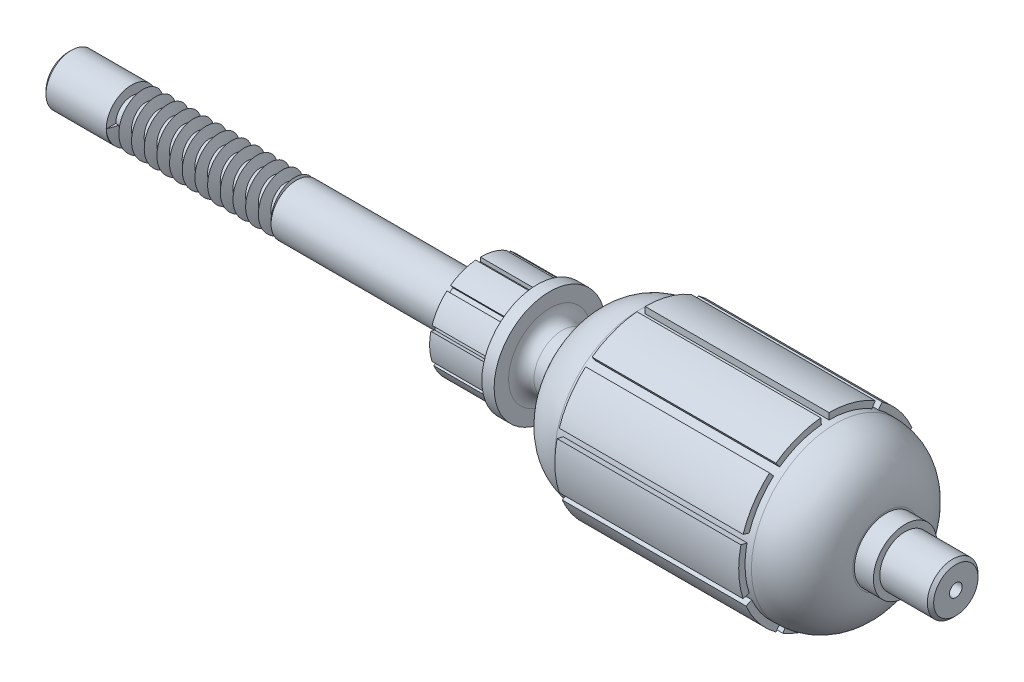
from build123d import *

# Parameters (mm, degrees)
CHANFREIN1_SIZE              = 0.5
ESQUISSE4_OUTSIDE_W          = 59.638
ESQUISSE4_OUTSIDE_H          = 59.638
ESQUISSE4_OUTSIDE_R          = 2.5
ENL_V_MAT_EXTRU_1_DEPTH      = 26
BOSS_BALAYAGE1_PITCH         = 2
ENL_V_START                  = -10
ENL_V_MAT_EXTRU_2_DEPTH      = 10
ENL_V_MAT_EXTRU_3_REACH      = 123.68
R_P_TITION_CIRCULAIRE1_COUNT = 10


with BuildPart() as part:
    # Esquisse1 → Base-Révolution (revolve)
    with BuildSketch(Plane.XY, mode=Mode.PRIVATE) as base_r_volution_sk:
        with BuildLine():
            Line((-105.052436647, 1), (-105.052436647, 4))
            Line((-105.052436647, 4), (-40.052436647, 4))
            Line((-40.052436647, 4), (-40.052436647, 8))
            Line((-40.052436647, 8), (-31.052436647, 8))
            Line((-31.052436647, 8), (-31.052436647, 8.760243155))
            Line((-31.052436647, 8.760243155), (-29.114476015, 8.760243155))
            Line((-29.114476015, 8.760243155), (-29.114476015, 6.476840737))
            ThreePointArc((-29.114476015, 6.476840737), (-28.528689578, 5.062627175), (-27.114476015, 4.476840737))
            Line((-27.114476015, 4.476840737), (-24.976894406, 4.476840737))
            ThreePointArc((-24.976894406, 4.476840737), (-23.652269232, 4.978385484), (-22.992002854, 6.23147259))
            ThreePointArc((-22.992002854, 6.23147259), (-20.350937345, 11.243821015), (-15.052436647, 13.25))
            Line((-15.052436647, 13.25), (-14.052436647, 13.25))
            Line((-14.052436647, 13.25), (-14.052436647, 14.25))
            Line((-14.052436647, 14.25), (14.947563353, 14.25))
            Line((14.947563353, 14.25), (14.947563353, 13.25))
            Line((14.947563353, 13.25), (15.947563353, 13.25))
            ThreePointArc((15.947563353, 13.25), (21.604417602, 10.906854249), (23.947563353, 5.25))
            Line((23.947563353, 5.25), (23.947563353, 5))
            Line((23.947563353, 5), (26.947563353, 5))
            Line((26.947563353, 5), (26.947563353, 4))
            Line((26.947563353, 4), (34.947563353, 4))
            Line((34.947563353, 4), (34.947563353, 1))
            Line((34.947563353, 1), (32.754382333, 1))
            Line((32.754382333, 1), (32.356358295, 0))
            Line((32.356358295, 0), (-102.501422425, 0))
            Line((-102.501422425, 0), (-103.007998472, 1))
            Line((-103.007998472, 1), (-105.052436647, 1))
        make_face()
    revolve(base_r_volution_sk.sketch.rotate(Axis((-132.149317739, 0, 0), (1, 0, 0)), 90), axis=Axis((-132.149317739, 0, 0), (1, 0, 0)))

    # Chanfrein1
    chanfrein1_edges = [part.edges().sort_by_distance(p)[0] for p in [
        (-105.052436647, 0, -4),
        (34.947563353, 0, -4),
    ]]
    chamfer(chanfrein1_edges, length=CHANFREIN1_SIZE)

    # Esquisse4 outside → Enlèv. mat.-Extru.1 (cut)
    with BuildSketch(Plane.ZY.offset(95.052436647)):
        Rectangle(ESQUISSE4_OUTSIDE_W, ESQUISSE4_OUTSIDE_H)
        Circle(ESQUISSE4_OUTSIDE_R, mode=Mode.SUBTRACT)
    extrude(amount=-ENL_V_MAT_EXTRU_1_DEPTH, mode=Mode.SUBTRACT)

    # Boss.-Balayage1: the profile of Esquisse5 profile screwed along a right-hand helix of 13 turns, 8 arcs to a turn; built about Z, then put on its axis
    boss_balayage1_z = Axis((0, 0, 0), (0, 0, 1))
    boss_balayage1_corners = [(2.4997, 0, 0.500100096), (2.4997, 0, -0.500100096), (3.998568427, 0, 0)]
    with BuildLine(mode=Mode.PRIVATE) as boss_balayage1_profile:
        Line(boss_balayage1_corners[0], boss_balayage1_corners[1])
        Line(boss_balayage1_corners[1], boss_balayage1_corners[2])
        Line(boss_balayage1_corners[2], boss_balayage1_corners[0])
    boss_balayage1_cap = Face(boss_balayage1_profile.wire())
    boss_balayage1_turn_angles = [0, 22.5, 45, 67.5, 90, 112.5, 135, 157.5, 180, 202.5, 225, 247.5, 270, 292.5, 315, 337.5, 360]
    boss_balayage1_turn_weights = [1, 0.9238795325112867, 1, 0.9238795325112867, 1, 0.9238795325112867, 1, 0.9238795325112867, 1, 0.9238795325112867, 1, 0.9238795325112867, 1, 0.9238795325112867, 1, 0.9238795325112867, 1]
    boss_balayage1_turn_rails = [Edge.make_bspline([Vector(p[0], p[1], 0).rotate(boss_balayage1_z, boss_balayage1_turn_angles[k]) / boss_balayage1_turn_weights[k] + Vector(0, 0, p[2] + BOSS_BALAYAGE1_PITCH * boss_balayage1_turn_angles[k] / 360) for k in range(17)], [0, 0, 0, 1, 1, 2, 2, 3, 3, 4, 4, 5, 5, 6, 6, 7, 7, 8, 8, 8], 2, boss_balayage1_turn_weights) for p in boss_balayage1_corners]
    boss_balayage1_turn_sides = [Face.make_surface_from_curves(boss_balayage1_turn_rails[p[0]], boss_balayage1_turn_rails[p[1]]) for p in [(0, 1), (1, 2), (2, 0)]]
    boss_balayage1 = Plane(origin=(-95.052436647, 0, 0), x_dir=(0, 0, 1), z_dir=(1, 0, 0)) * Solid(Shell([*[p.moved(Location((0, 0, BOSS_BALAYAGE1_PITCH * i))) for i in range(13) for p in boss_balayage1_turn_sides], boss_balayage1_cap, boss_balayage1_cap.rotate(boss_balayage1_z, 4680).moved(Location((0, 0, BOSS_BALAYAGE1_PITCH * 4680 / 360)))]))
    add(boss_balayage1)

    # Esquisse6 → Enlèv. mat.-Extru.2 (cut)
    with BuildSketch(Plane.ZY.offset(40.052436647).offset(ENL_V_START)):
        with BuildLine():
            Line((0, 7.37654321), (0, 8))
            ThreePointArc((0, 8), (0.366656139, 7.991593288), (0.732541685, 7.966390819))
            Line((0.732541685, 7.966390819), (0.675453174, 7.345553263))
            ThreePointArc((0.675453174, 7.345553263), (0.338081856, 7.36879165), (0, 7.37654321))
        make_face()
        with BuildLine():
            Line((-4.335823312, 5.967748817), (-4.702282018, 6.472135955))
            ThreePointArc((-4.702282018, 6.472135955), (-4.400709629, 6.680849853), (-4.089888366, 6.875522755))
            Line((-4.089888366, 6.875522755), (-3.771154781, 6.339698837))
            ThreePointArc((-3.771154781, 6.339698837), (-4.057753092, 6.160197202), (-4.335823312, 5.967748817))
        make_face()
        with BuildLine():
            Line((-7.015509487, 2.279477212), (-7.60845213, 2.472135955))
            ThreePointArc((-7.60845213, 2.472135955), (-7.487153894, 2.818248848), (-7.35012007, 3.158438689))
            Line((-7.35012007, 3.158438689), (-6.777309787, 2.912294934))
            ThreePointArc((-6.777309787, 2.912294934), (-6.903664277, 2.598616801), (-7.015509487, 2.279477212))
        make_face()
        with BuildLine():
            Line((-7.015509487, -2.279477212), (-7.60845213, -2.472135955))
            ThreePointArc((-7.60845213, -2.472135955), (-7.71375985, -2.120827428), (-7.802855729, -1.765061604))
            Line((-7.802855729, -1.765061604), (-7.194762806, -1.627506649))
            ThreePointArc((-7.194762806, -1.627506649), (-7.112610355, -1.955546895), (-7.015509487, -2.279477212))
        make_face()
        with BuildLine():
            Line((-4.335823312, -5.967748817), (-4.702282018, -6.472135955))
            ThreePointArc((-4.702282018, -6.472135955), (-4.993971724, -6.249819711), (-5.275165709, -6.014368358))
            Line((-5.275165709, -6.014368358), (-4.864060974, -5.545656009))
            ThreePointArc((-4.864060974, -5.545656009), (-4.604781027, -5.762758144), (-4.335823312, -5.967748817))
        make_face()
        with BuildLine():
            Line((0, -7.37654321), (0, -8))
            ThreePointArc((0, -8), (-0.366656139, -7.991593288), (-0.732541685, -7.966390819))
            Line((-0.732541685, -7.966390819), (-0.675453174, -7.345553263))
            ThreePointArc((-0.675453174, -7.345553263), (-0.338081856, -7.36879165), (0, -7.37654321))
        make_face()
        with BuildLine():
            Line((4.335823312, -5.967748817), (4.702282018, -6.472135955))
            ThreePointArc((4.702282018, -6.472135955), (4.400709629, -6.680849853), (4.089888366, -6.875522755))
            Line((4.089888366, -6.875522755), (3.771154781, -6.339698837))
            ThreePointArc((3.771154781, -6.339698837), (4.057753092, -6.160197202), (4.335823312, -5.967748817))
        make_face()
        with BuildLine():
            Line((7.015509487, -2.279477212), (7.60845213, -2.472135955))
            ThreePointArc((7.60845213, -2.472135955), (7.487153894, -2.818248848), (7.35012007, -3.158438689))
            Line((7.35012007, -3.158438689), (6.777309787, -2.912294934))
            ThreePointArc((6.777309787, -2.912294934), (6.903664277, -2.598616801), (7.015509487, -2.279477212))
        make_face()
        with BuildLine():
            Line((7.015509487, 2.279477212), (7.60845213, 2.472135955))
            ThreePointArc((7.60845213, 2.472135955), (7.71375985, 2.120827428), (7.802855729, 1.765061604))
            Line((7.802855729, 1.765061604), (7.194762806, 1.627506649))
            ThreePointArc((7.194762806, 1.627506649), (7.112610355, 1.955546895), (7.015509487, 2.279477212))
        make_face()
        with BuildLine():
            Line((4.335823312, 5.967748817), (4.702282018, 6.472135955))
            ThreePointArc((4.702282018, 6.472135955), (4.993971724, 6.249819711), (5.275165709, 6.014368358))
            Line((5.275165709, 6.014368358), (4.864060974, 5.545656009))
            ThreePointArc((4.864060974, 5.545656009), (4.604781027, 5.762758144), (4.335823312, 5.967748817))
        make_face()
    extrude(amount=ENL_V_MAT_EXTRU_2_DEPTH, mode=Mode.SUBTRACT)

    # Esquisse7 → Enlèv. mat.-Extru.3 (cut, up to next)
    with BuildSketch(Plane(origin=(14.947563353, 0, 0), x_dir=(0, 0, -1), z_dir=(1, 0, 0)), mode=Mode.PRIVATE) as enl_v_mat_extru_3_sk1:
        with BuildLine():
            Line((0, 14.25), (0, 13.25))
            ThreePointArc((0, 13.25), (-0.60727423, 13.236076383), (-1.213272165, 13.194334794))
            Line((-1.213272165, 13.194334794), (-1.304839876, 14.190133646))
            ThreePointArc((-1.304839876, 14.190133646), (-0.653106247, 14.235025544), (0, 14.25))
        make_face()
    enl_v_mat_extru_3_tool1 = extrude(enl_v_mat_extru_3_sk1.sketch, amount=-ENL_V_MAT_EXTRU_3_REACH, mode=Mode.PRIVATE) & part.part
    enl_v_mat_extru_3 = enl_v_mat_extru_3_tool1.solids().sort_by_distance((14.947563, 13.736791, 0.630247))[0]
    add(enl_v_mat_extru_3, mode=Mode.SUBTRACT)

    # Répétition circulaire1: Enlèv. mat.-Extru.3 ×10 about axis
    r_p_tition_circulaire1_axis = Axis((-114.02027788, 0, 0), (1, 0, 0))
    for i in range(1, R_P_TITION_CIRCULAIRE1_COUNT):
        add(enl_v_mat_extru_3.rotate(r_p_tition_circulaire1_axis, i * 360 / R_P_TITION_CIRCULAIRE1_COUNT), mode=Mode.SUBTRACT)


solid = part.part
